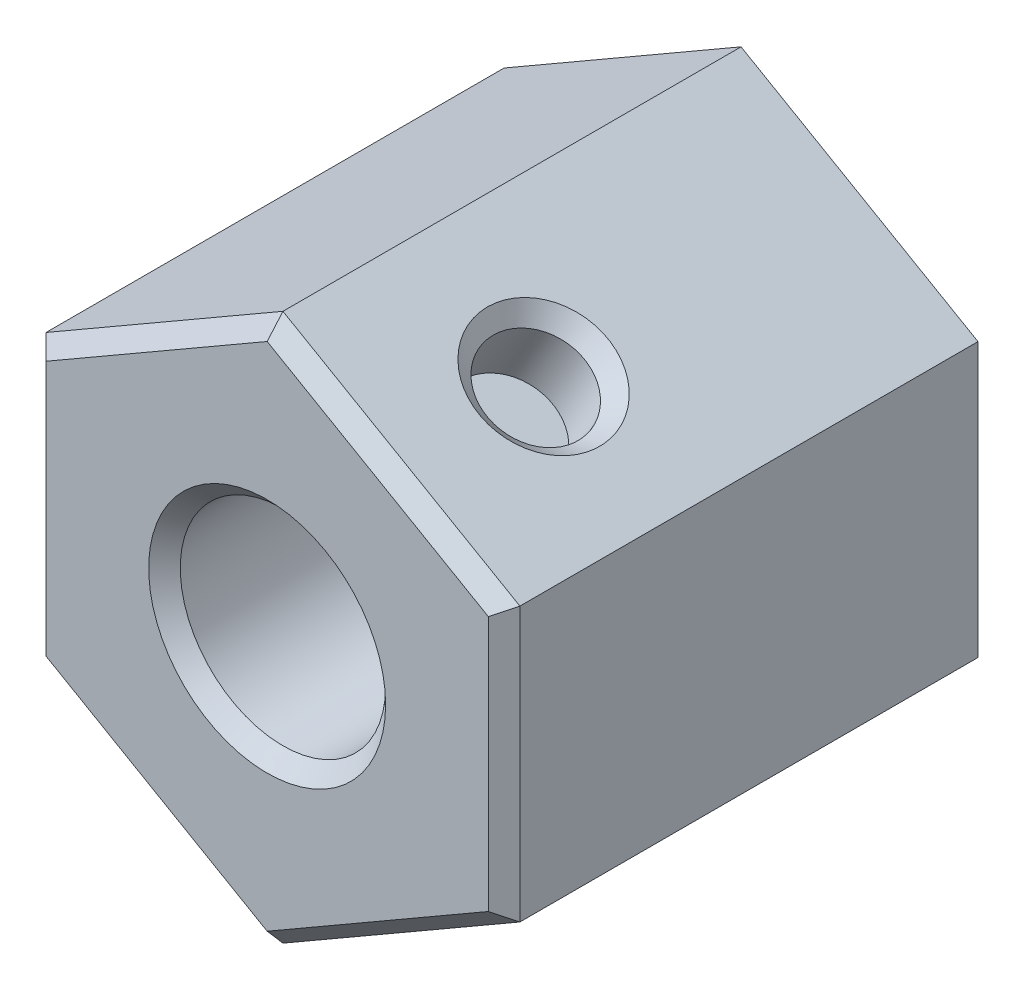
from build123d import *

# Parameters (mm, degrees)
BOSS_EXTRUDE1_DEPTH = 15
SKETCH2_R           = 3.25
CUT_EXTRUDE1_DEPTH  = 15
CUT_EXTRUDE2_DEPTH  = 2.5
SKETCH4_R           = 1.55
CUT_EXTRUDE3_DEPTH  = 2.5
CIRPATTERN1_COUNT   = 3
CHAMFER1_SIZE       = 0.5
CHAMFER2_SIZE       = 0.5
CHAMFER3_SIZE       = 0.5


with BuildPart() as part:
    # Sketch1 → Boss-Extrude1 (new body)
    with BuildSketch(Plane.XY):
        Polygon((0, 8.660254038), (-7.5, 4.330127019), (-7.5, -4.330127019), (0, -8.660254038), (7.5, -4.330127019), (7.5, 4.330127019), align=None)
    extrude(amount=BOSS_EXTRUDE1_DEPTH)

    # Sketch2 → Cut-Extrude1 (cut)
    with BuildSketch(Plane.XY.offset(15)):
        Circle(SKETCH2_R)
    extrude(amount=-CUT_EXTRUDE1_DEPTH, mode=Mode.SUBTRACT)

    # Sketch3 → Cut-Extrude2 (cut)
    with BuildSketch(Plane(origin=(0, 0, 0), x_dir=(-1, 0, 0), z_dir=(0, 0, -1))):
        Polygon((0, 5.888972746), (-5.1, 2.944486373), (-5.1, -2.944486373), (0, -5.888972746), (5.1, -2.944486373), (5.1, 2.944486373), align=None)
    extrude(amount=-CUT_EXTRUDE2_DEPTH, mode=Mode.SUBTRACT)

    # Sketch4 → Cut-Extrude3 (cut)
    with BuildSketch(Plane(origin=(3.75, 6.495190528, 0), x_dir=(0.8660254037844417, -0.4999999999999949, 0), z_dir=(0.4999999999999949, 0.8660254037844417, 0))):
        with Locations((0, -10)):
            Circle(SKETCH4_R)
    cut_extrude3 = extrude(amount=-CUT_EXTRUDE3_DEPTH, mode=Mode.SUBTRACT)

    # CirPattern1: Cut-Extrude3 ×3 about axis
    cirpattern1_axis = Axis((0, 0, 15), (0, 0, 1))
    for i in range(1, CIRPATTERN1_COUNT):
        add(cut_extrude3.rotate(cirpattern1_axis, i * 360 / CIRPATTERN1_COUNT), mode=Mode.SUBTRACT)

    # Chamfer1
    chamfer1_edges = [part.edges().sort_by_distance(p)[0] for p in [
        (7.5, 0, 15),
        (3.75, -6.495190528, 15),
        (-3.75, -6.495190528, 15),
        (-7.5, 0, 15),
        (-3.75, 6.495190528, 15),
        (3.75, 6.495190528, 15),
        (-3.25, 0, 15),
    ]]
    chamfer(chamfer1_edges, length=CHAMFER1_SIZE)

    # Chamfer2
    chamfer2_edges = [part.edges().sort_by_distance(p)[0] for p in [
        (-7.5, -1.55, 10),
        (5.092339376, -5.720190528, 10),
        (2.407660624, 7.270190528, 10),
    ]]
    chamfer(chamfer2_edges, length=CHAMFER2_SIZE)

    # Chamfer3
    chamfer3_edges = [part.edges().sort_by_distance(p)[0] for p in [
        (-3.25, 0, 2.5),
    ]]
    chamfer(chamfer3_edges, length=CHAMFER3_SIZE)


solid = part.part
